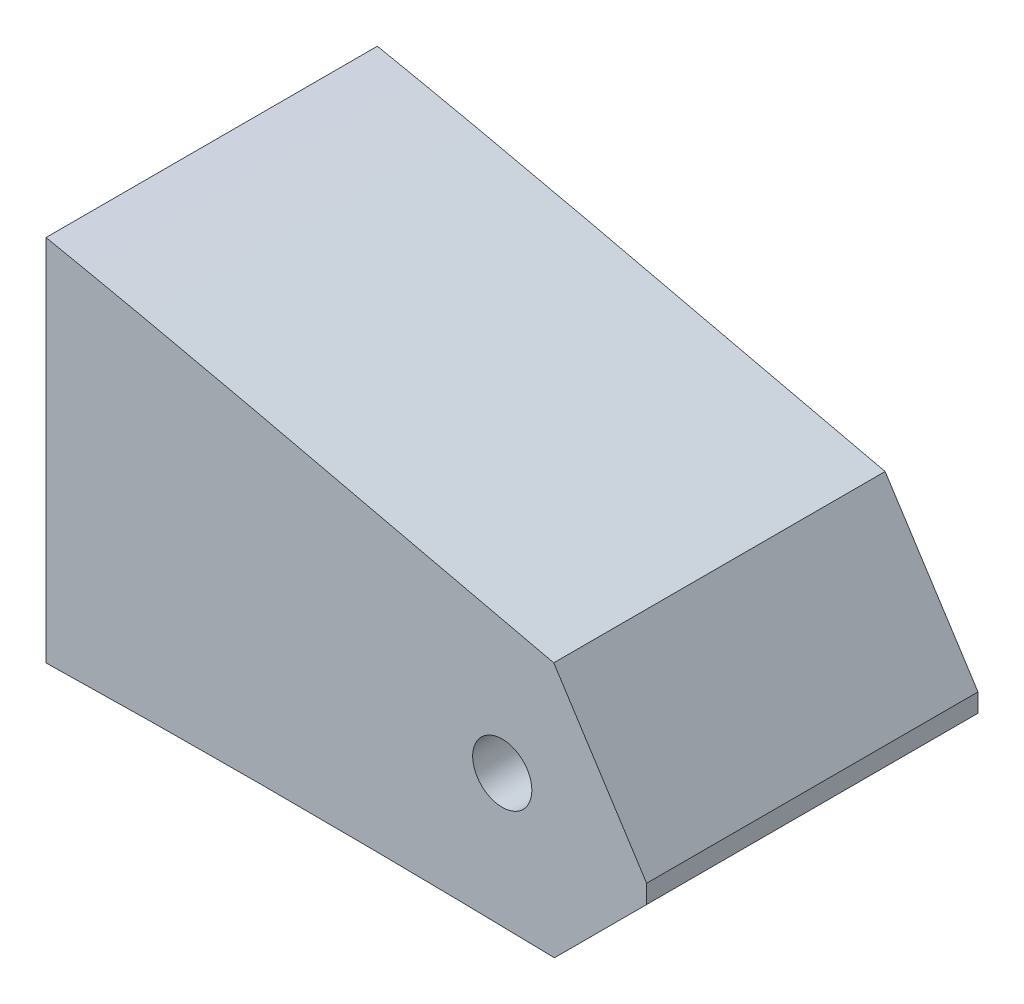
from build123d import *

# Parameters (mm, degrees)
SKETCH1_R           = 1.984375
BOSS_EXTRUDE1_DEPTH = 22.225
SKETCH2_W           = 138.275381465
SKETCH2_H           = 53.36276468
CUT_EXTRUDE1_DEPTH  = 28.956


with BuildPart() as part:
    # Sketch1 → Boss-Extrude1 (new body)
    with BuildSketch(Plane.XY):
        with BuildLine():
            Line((82.000179898, -8.186219891), (88.185394895, -2.001004894))
            Line((88.185394895, -2.001004894), (88.185394895, -0.762205858))
            Line((88.185394895, -0.762205858), (81.956708556, 8.927361732))
            add(Edge.make_bspline(
                [(81.956708556, 8.927361732), (63.030745543, 13.220924999), (32.912542011, 21.054810463), (-8.788263943, 22.493415957), (-37.022679839, 17.048784836), (-56.468813366, 7.942395598), (-69.750877423, -1.183598796), (-75.653529273, -9.088547658), (-76.263572997, -14.630281591)],
                knots=[0, 0, 0, 0, 0.32618996, 0.519062206, 0.695896567, 0.802481405, 0.87763184, 0.964218833, 0.964218833, 0.964218833, 0.964218833], degree=3))
            add(Edge.make_bspline(
                [(-76.263572997, -14.630281591), (-75.337207227, -19.844517219), (-64.729939397, -19.291040394), (-48.811844157, -19.222752204), (-26.183233303, -15.072844754), (18.218517547, -8.237574938), (55.340758309, -7.560466587), (82.000179898, -8.186219891)],
                knots=[0.037175639, 0.037175639, 0.037175639, 0.037175639, 0.117655916, 0.187765701, 0.340509098, 0.519845917, 1, 1, 1, 1], degree=3))
        make_face()
        with Locations((78.5029552, 0.789628069)):
            Circle(SKETCH1_R, mode=Mode.SUBTRACT)
    extrude(amount=BOSS_EXTRUDE1_DEPTH)

    # Sketch2 → Cut-Extrude1 (cut)
    with BuildSketch(Plane.XY.offset(22.225)):
        with Locations((-21.234155838, 4.011118028)):
            Rectangle(SKETCH2_W, SKETCH2_H)
    extrude(amount=-CUT_EXTRUDE1_DEPTH, mode=Mode.SUBTRACT)


solid = part.part
